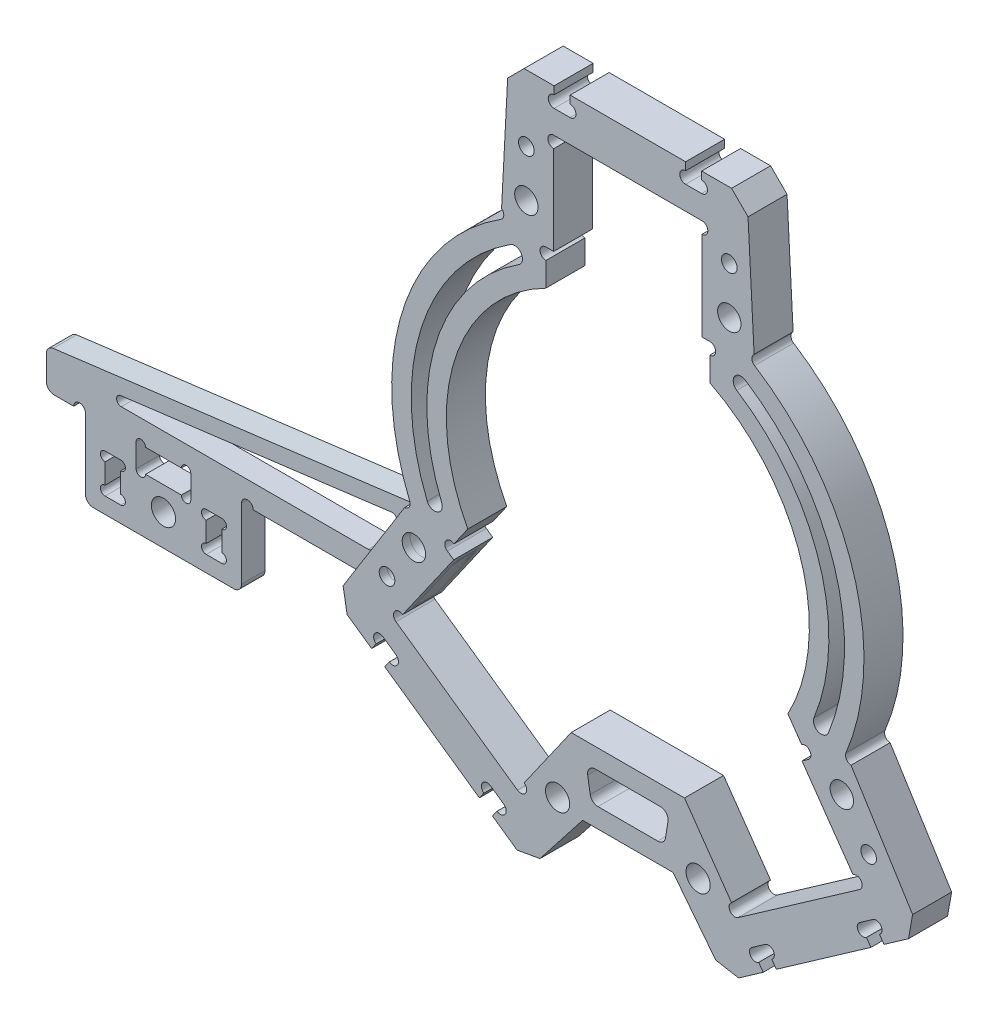
from build123d import *

# Parameters (mm, degrees)
F_5MM_START         = -2.5
F_5MM_OUTLINE_R     = 1.55
F_5MM_OUTLINE_R_2   = 1
F_5MM_OUTLINE_R_3   = 1.5
F_5MM_DEPTH         = 5
SKETCH_2_R          = 1
SKETCH_2_R_2        = 1.5
EXTRUDE_1_DEPTH     = 1.5
SKETCH_3_R          = 0.75
CUT_EXTRUDE_1_DEPTH = 88.340929462
SKETCH_4_R          = 1.55
SKETCH_4_W          = 2
SKETCH_4_H          = 5
SKETCH_4_W_2        = 7
SKETCH_4_H_2        = 3
CUT_EXTRUDE_2_DEPTH = 88.340929462
SKETCH_6_R          = 0.6
CUT_EXTRUDE_3_DEPTH = 88.340929462
FILLET_1_R          = 1
CUT_EXTRUDE_4_DEPTH = 88.340929462
FILLET_3_R          = 0.6
FILLET_5_R          = 1


# Read off the part's stored shape, not the designer's step: 三角滚珠轨道连接板（中）_5mm
with BuildPart() as part:
    # 三角滚珠轨道连接板（中）_5mm outline → 三角滚珠轨道连接板（中）_5mm (new body)
    with BuildSketch(Plane.XY.offset(F_5MM_START)):
        with BuildLine():
            Line((5.796130384, -35.93416405), (11.257076763, -42.923856671))
            Line((11.257076763, -42.923856671), (14.196586924, -43.442171622))
            Line((14.196586924, -43.442171622), (17.340691348, -41.240646003))
            Line((17.340691348, -41.240646003), (16.767114912, -40.421493959))
            ThreePointArc((16.767114912, -40.421493959), (15.722568551, -40.237312253), (15.906750257, -39.192765892))
            Line((15.906750257, -39.192765892), (17.586011948, -38.016934198))
            ThreePointArc((17.586011948, -38.016934198), (18.630558309, -38.201115903), (18.446376603, -39.245662264))
            Line((18.446376603, -39.245662264), (19.019953039, -40.064814309))
            Line((19.019953039, -40.064814309), (31.143403294, -31.575883051))
            Line((31.143403294, -31.575883051), (30.569826858, -30.756731006))
            ThreePointArc((30.569826858, -30.756731006), (29.525280498, -30.5725493), (29.709462204, -29.52800294))
            Line((29.709462204, -29.52800294), (31.388723894, -28.352171245))
            ThreePointArc((31.388723894, -28.352171245), (32.433270255, -28.536352951), (32.249088549, -29.580899312))
            Line((32.249088549, -29.580899312), (32.822664985, -30.400051356))
            Line((32.822664985, -30.400051356), (35.96676941, -28.198525737))
            Line((35.96676941, -28.198525737), (36.485084361, -25.259015576))
            Line((36.485084361, -25.259015576), (28.594617596, -12.631629161))
            ThreePointArc((28.594617596, -12.631629161), (28.003923126, -12.280440438), (27.947220205, -11.595576762))
            ThreePointArc((27.947220205, -11.595576762), (28.856904848, 9.098547149), (16.242072966, 25.52840738))
            ThreePointArc((16.242072966, 25.52840738), (15.895699614, 26.12193832), (16.17813462, 26.748423709))
            Line((16.17813462, 26.748423709), (15.398855301, 41.617958914))
            Line((15.398855301, 41.617958914), (13.288242786, 43.728571429))
            Line((13.288242786, 43.728571429), (9.45, 43.728571429))
            Line((9.45, 43.728571429), (9.45, 42.728571429))
            ThreePointArc((9.45, 42.728571429), (10.2, 41.978571429), (9.45, 41.228571429))
            Line((9.45, 41.228571429), (7.4, 41.228571429))
            ThreePointArc((7.4, 41.228571429), (6.65, 41.978571429), (7.4, 42.728571429))
            Line((7.4, 42.728571429), (7.4, 43.728571429))
            Line((7.4, 43.728571429), (-7.4, 43.728571429))
            Line((-7.4, 43.728571429), (-7.4, 42.728571429))
            ThreePointArc((-7.4, 42.728571429), (-6.65, 41.978571429), (-7.4, 41.228571429))
            Line((-7.4, 41.228571429), (-9.45, 41.228571429))
            ThreePointArc((-9.45, 41.228571429), (-10.2, 41.978571429), (-9.45, 42.728571429))
            Line((-9.45, 42.728571429), (-9.45, 43.728571429))
            Line((-9.45, 43.728571429), (-13.288242786, 43.728571429))
            Line((-13.288242786, 43.728571429), (-15.398855301, 41.617958914))
            Line((-15.398855301, 41.617958914), (-16.17813462, 26.748423709))
            ThreePointArc((-16.17813462, 26.748423709), (-15.895699614, 26.12193832), (-16.242072966, 25.52840738))
            ThreePointArc((-16.242072966, 25.52840738), (-28.856904848, 9.098547149), (-27.947220205, -11.595576762))
            ThreePointArc((-27.947220205, -11.595576762), (-28.003923126, -12.280440438), (-28.594617596, -12.631629161))
            Line((-28.594617596, -12.631629161), (-36.485084361, -25.259015576))
            Line((-36.485084361, -25.259015576), (-35.96676941, -28.198525737))
            Line((-35.96676941, -28.198525737), (-32.822664985, -30.400051356))
            Line((-32.822664985, -30.400051356), (-32.249088549, -29.580899312))
            ThreePointArc((-32.249088549, -29.580899312), (-32.433270255, -28.536352951), (-31.388723894, -28.352171245))
            Line((-31.388723894, -28.352171245), (-29.709462204, -29.52800294))
            ThreePointArc((-29.709462204, -29.52800294), (-29.525280498, -30.5725493), (-30.569826858, -30.756731006))
            Line((-30.569826858, -30.756731006), (-31.143403294, -31.575883051))
            Line((-31.143403294, -31.575883051), (-19.019953039, -40.064814309))
            Line((-19.019953039, -40.064814309), (-18.446376603, -39.245662264))
            ThreePointArc((-18.446376603, -39.245662264), (-18.630558309, -38.201115903), (-17.586011948, -38.016934198))
            Line((-17.586011948, -38.016934198), (-15.906750257, -39.192765892))
            ThreePointArc((-15.906750257, -39.192765892), (-15.722568551, -40.237312253), (-16.767114912, -40.421493959))
            Line((-16.767114912, -40.421493959), (-17.340691348, -41.240646003))
            Line((-17.340691348, -41.240646003), (-14.196586924, -43.442171622))
            Line((-14.196586924, -43.442171622), (-11.257076763, -42.923856671))
            Line((-11.257076763, -42.923856671), (-5.796130384, -35.93416405))
            Line((-5.796130384, -35.93416405), (5.796130384, -35.93416405))
        make_face()
        with Locations((-9, -35)):
            Circle(F_5MM_OUTLINE_R, mode=Mode.SUBTRACT)
        with Locations((-30.855255033, -21.401062631)):
            Circle(F_5MM_OUTLINE_R_2, mode=Mode.SUBTRACT)
        with Locations((-27.413796415, -16.486150365)):
            Circle(F_5MM_OUTLINE_R_3, mode=Mode.SUBTRACT)
        with Locations((9, -35)):
            Circle(F_5MM_OUTLINE_R, mode=Mode.SUBTRACT)
        with BuildLine():
            Line((-4.159079319, -29.43416405), (4.159079319, -29.43416405))
            ThreePointArc((4.159079319, -29.43416405), (4.920909908, -29.786387736), (5.146070941, -30.594935743))
            Line((5.146070941, -30.594935743), (4.820289669, -32.594935743))
            ThreePointArc((4.820289669, -32.594935743), (4.481074361, -33.195994639), (3.833298046, -33.43416405))
            Line((3.833298046, -33.43416405), (-3.833298046, -33.43416405))
            ThreePointArc((-3.833298046, -33.43416405), (-4.481074361, -33.195994639), (-4.820289669, -32.594935743))
            Line((-4.820289669, -32.594935743), (-5.146070941, -30.594935743))
            ThreePointArc((-5.146070941, -30.594935743), (-4.920909908, -29.786387736), (-4.159079319, -29.43416405))
        make_face(mode=Mode.SUBTRACT)
        with Locations((30.855255033, -21.401062631)):
            Circle(F_5MM_OUTLINE_R_2, mode=Mode.SUBTRACT)
        with Locations((27.413796415, -16.486150365)):
            Circle(F_5MM_OUTLINE_R_3, mode=Mode.SUBTRACT)
        with BuildLine():
            ThreePointArc((-15.041908084, 23.328287396), (-13.65956224, 23.02975772), (-13.958091916, 21.647411876))
            ThreePointArc((-13.958091916, 21.647411876), (-24.565178569, 7.745371051), (-23.850244887, -9.726489073))
            ThreePointArc((-23.850244887, -9.726489073), (-24.398584697, -11.030070084), (-25.702165708, -10.481730275))
            ThreePointArc((-25.702165708, -10.481730275), (-26.472612471, 8.346782651), (-15.041908084, 23.328287396))
        make_face(mode=Mode.SUBTRACT)
        with Locations((-13, 29.228571429)):
            Circle(F_5MM_OUTLINE_R_3, mode=Mode.SUBTRACT)
        with Locations((-13, 35.228571429)):
            Circle(F_5MM_OUTLINE_R_2, mode=Mode.SUBTRACT)
        with BuildLine():
            Line((-10.5, 25.328571429), (-9.5, 25.328571429))
            Line((-9.5, 25.328571429), (-9.5, 36.728571429))
            ThreePointArc((-9.5, 36.728571429), (-10.25, 37.478571429), (-9.5, 38.228571429))
            Line((-9.5, 38.228571429), (9.5, 38.228571429))
            ThreePointArc((9.5, 38.228571429), (10.25, 37.478571429), (9.5, 36.728571429))
            Line((9.5, 36.728571429), (9.5, 25.328571429))
            Line((9.5, 25.328571429), (10.5, 25.328571429))
            ThreePointArc((10.5, 25.328571429), (11.25, 24.578571429), (10.5, 23.828571429))
            Line((10.5, 23.828571429), (10.5, 20.752162415))
            ThreePointArc((10.5, 20.752162415), (22.180886192, 6.993606553), (20.50404783, -10.976623684))
            Line((20.50404783, -10.976623684), (22.268603548, -13.496670417))
            ThreePointArc((22.268603548, -13.496670417), (23.313149909, -13.680852122), (23.128968203, -14.725398483))
            Line((23.128968203, -14.725398483), (22.309816159, -15.298974919))
            Line((22.309816159, -15.298974919), (28.848587533, -24.637308224))
            ThreePointArc((28.848587533, -24.637308224), (29.893133893, -24.82148993), (29.708952188, -25.866036291))
            Line((29.708952188, -25.866036291), (14.145063346, -36.763988581))
            ThreePointArc((14.145063346, -36.763988581), (13.100516986, -36.579806875), (13.284698692, -35.535260515))
            Line((13.284698692, -35.535260515), (7.26214611, -26.93416405))
            Line((7.26214611, -26.93416405), (-7.26214611, -26.93416405))
            Line((-7.26214611, -26.93416405), (-13.284698692, -35.535260515))
            ThreePointArc((-13.284698692, -35.535260515), (-13.100516986, -36.579806875), (-14.145063346, -36.763988581))
            Line((-14.145063346, -36.763988581), (-29.708952188, -25.866036291))
            ThreePointArc((-29.708952188, -25.866036291), (-29.893133893, -24.82148993), (-28.848587533, -24.637308224))
            Line((-28.848587533, -24.637308224), (-22.309816159, -15.298974919))
            Line((-22.309816159, -15.298974919), (-23.128968203, -14.725398483))
            ThreePointArc((-23.128968203, -14.725398483), (-23.313149909, -13.680852122), (-22.268603548, -13.496670417))
            Line((-22.268603548, -13.496670417), (-20.50404783, -10.976623684))
            ThreePointArc((-20.50404783, -10.976623684), (-22.180886192, 6.993606553), (-10.5, 20.752162415))
            Line((-10.5, 20.752162415), (-10.5, 23.828571429))
            ThreePointArc((-10.5, 23.828571429), (-11.25, 24.578571429), (-10.5, 25.328571429))
        make_face(mode=Mode.SUBTRACT)
        with BuildLine():
            ThreePointArc((13.958091916, 21.647411876), (13.65956224, 23.02975772), (15.041908084, 23.328287396))
            ThreePointArc((15.041908084, 23.328287396), (26.472612471, 8.346782651), (25.702165708, -10.481730275))
            ThreePointArc((25.702165708, -10.481730275), (24.398584697, -11.030070084), (23.850244887, -9.726489073))
            ThreePointArc((23.850244887, -9.726489073), (24.565178569, 7.745371051), (13.958091916, 21.647411876))
        make_face(mode=Mode.SUBTRACT)
        with Locations((13, 29.228571429)):
            Circle(F_5MM_OUTLINE_R_3, mode=Mode.SUBTRACT)
        with Locations((13, 35.228571429)):
            Circle(F_5MM_OUTLINE_R_2, mode=Mode.SUBTRACT)
    extrude(amount=F_5MM_DEPTH)


with BuildPart() as body_2:
    # 草图2 → 凸台-拉伸1 (new, symmetric)
    with BuildSketch(Plane.XY):
        Polygon((-70.5, -23.6), (-70.5, -33.6), (-50.5, -33.6), (-50.5, -23.6), (-35.448416374, -23.6), (-28.848587533, -24.637308224), (-22.309816159, -15.298974919), (-28.594617596, -12.631629161), (-75.5, -18.6), (-75.5, -23.6), align=None)
        with Locations((-30.855255033, -21.401062631)):
            Circle(SKETCH_2_R, mode=Mode.SUBTRACT)
        with Locations((-27.413796415, -16.486150365)):
            Circle(SKETCH_2_R_2, mode=Mode.SUBTRACT)
    extrude(amount=EXTRUDE_1_DEPTH, both=True)

    # 草图3 → 切除-拉伸1 (cut, through all)
    with BuildSketch(Plane.XY.offset(1.5)):
        with Locations((-71.25, -23.6)):
            Circle(SKETCH_3_R)
        with Locations((-49.75, -23.6)):
            Circle(SKETCH_3_R)
    extrude(amount=-CUT_EXTRUDE_1_DEPTH, mode=Mode.SUBTRACT)

    # 草图4 → 切除-拉伸2 (cut, through all)
    with BuildSketch(Plane.XY.offset(1.5)):
        with Locations((-60.5, -29.6)):
            Circle(SKETCH_4_R)
        with Locations((-66.975, -29.05)):
            Rectangle(SKETCH_4_W, SKETCH_4_H)
        with Locations((-54.025, -29.05)):
            Rectangle(SKETCH_4_W, SKETCH_4_H)
        with Locations((-60.5, -25.05)):
            Rectangle(SKETCH_4_W_2, SKETCH_4_H_2)
    extrude(amount=-CUT_EXTRUDE_2_DEPTH, mode=Mode.SUBTRACT)

    # 草图6 → 切除-拉伸3 (cut, through all)
    with BuildSketch(Plane.XY.offset(1.5)):
        with Locations((-67.975, -27.15)):
            Circle(SKETCH_6_R)
        with Locations((-65.975, -27.15)):
            Circle(SKETCH_6_R)
        with Locations((-65.975, -30.95)):
            Circle(SKETCH_6_R)
        with Locations((-67.975, -30.95)):
            Circle(SKETCH_6_R)
        with Locations((-53.025, -30.95)):
            Circle(SKETCH_6_R)
        with Locations((-55.025, -30.95)):
            Circle(SKETCH_6_R)
        with Locations((-55.025, -27.15)):
            Circle(SKETCH_6_R)
        with Locations((-53.025, -27.15)):
            Circle(SKETCH_6_R)
        with Locations((-63.4, -26.55)):
            Circle(SKETCH_6_R)
        with Locations((-57.6, -26.55)):
            Circle(SKETCH_6_R)
        with Locations((-57.6, -23.55)):
            Circle(SKETCH_6_R)
        with Locations((-63.4, -23.55)):
            Circle(SKETCH_6_R)
    extrude(amount=-CUT_EXTRUDE_3_DEPTH, mode=Mode.SUBTRACT)

    # 圆角1
    fillet_1_edges = [body_2.edges().sort_by_distance(p)[0] for p in [
        (-50.5, -33.6, 0),
        (-70.5, -33.6, 0),
    ]]
    fillet(fillet_1_edges, radius=FILLET_1_R)

    # 草图7 → 切除-拉伸4 (cut, through all)
    with BuildSketch(Plane.XY.offset(1.5)):
        Polygon((-29.905671956, -14.814577064), (-75.373268139, -20.6), (-33.956668707, -20.6), align=None)
    extrude(amount=-CUT_EXTRUDE_4_DEPTH, mode=Mode.SUBTRACT)

    # 圆角3
    fillet_3_edges = [body_2.edges().sort_by_distance(p)[0] for p in [
        (-29.905671956, -14.814577064, 0),
        (-33.956668707, -20.6, 0),
        (-75.373268139, -20.6, 0),
    ]]
    fillet(fillet_3_edges, radius=FILLET_3_R)

    # 圆角5
    fillet_5_edges = [body_2.edges().sort_by_distance(p)[0] for p in [
        (-75.5, -23.6, 0),
        (-75.5, -18.6, 0),
        (-28.594617596, -12.631629161, 0),
        (-22.309816159, -15.298974919, 0),
        (-28.848587533, -24.637308224, 0),
        (-35.448416374, -23.6, 0),
    ]]
    fillet(fillet_5_edges, radius=FILLET_5_R)


solid = Compound([part.part, body_2.part])
